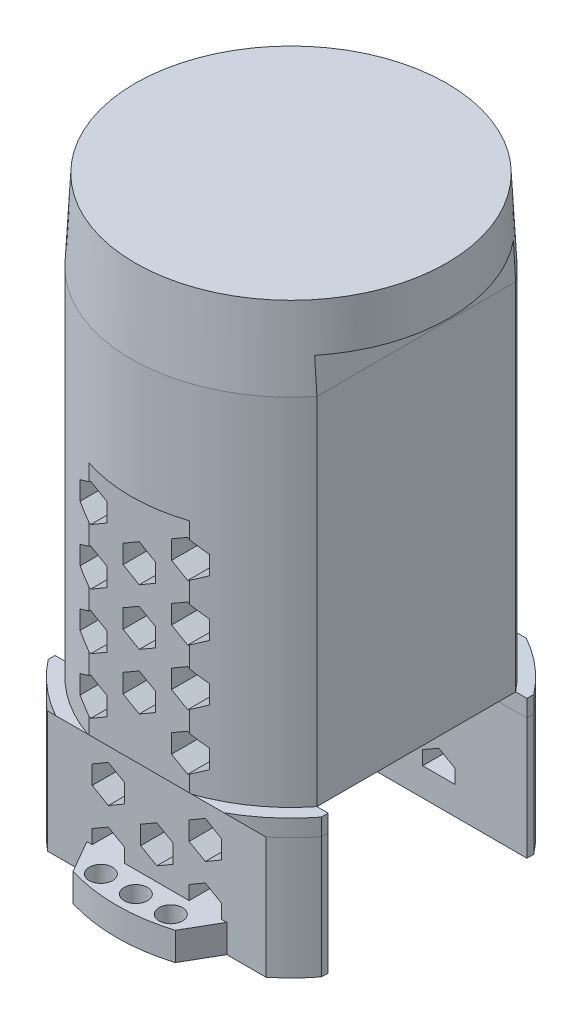
from build123d import *
from build123d.topology import SkipClean

# Parameters (mm, degrees)
BOSS_EXTRUDE1_DEPTH     = 520.7
BOSS_EXTRUDE1_2_DEPTH   = 520.7
SKETCH2_R               = 38.1
BOSS_EXTRUDE2_DEPTH     = 10
BOSS_EXTRUDE3_START     = -10
BOSS_EXTRUDE3_DEPTH     = 10
SKETCH4_R               = 2.5
CUT_EXTRUDE1_DEPTH      = 20
SKETCH10_W              = 228.663028749
SKETCH10_H              = 344.363478489
CUT_EXTRUDE4_DEPTH      = 410.956314746
SKETCH11_W              = 60.14534243
SKETCH11_H              = 11.693159143
CUT_EXTRUDE5_DEPTH      = 60
CHAMFER1_SIZE           = 10
SKETCH15_W              = 58.572001186
SKETCH15_H              = 104.3
BOSS_EXTRUDE7_DEPTH     = 1.465
SKETCH16_W              = 58.572001186
SKETCH16_H              = 104.3
BOSS_EXTRUDE8_DEPTH     = 1.465
FILL_START              = -28.775868134
FILL_PATTERN1_DEPTH     = 57.551736268
FILL_START_2            = -32.547438946
FILL_PATTERN2_DEPTH     = 65.094877892
BOSS_EXTRUDE4_START     = -6
SKETCH12_R              = 2.5
BOSS_EXTRUDE4_DEPTH     = 6
CUT_EXTRUDE6_DEPTH      = 127.363404522
CUT_EXTRUDE6_DEPTH_BACK = 127.363404522
SKETCH17_R              = 69.16149428
SKETCH17_R_2            = 37.4142
SKETCH18_W              = 106.589202293
SKETCH18_H              = 22.606
SKETCH18_H_2            = 1.34818374
CUT_EXTRUDE7_DEPTH      = 527.221851961
SKETCH19_W              = 10.555138929
SKETCH19_H              = 5.43269377
BOSS_EXTRUDE9_DEPTH     = 7.465
SKETCH20_W              = 9.747090017
SKETCH20_H              = 5.698331162
BOSS_EXTRUDE10_DEPTH    = 7.465
SKETCH21_W              = 30
SKETCH21_H              = 6
BOSS_EXTRUDE11_DEPTH    = 7.465
SKETCH22_W              = 30
SKETCH22_H              = 6
BOSS_EXTRUDE12_DEPTH    = 7.465
SKETCH23_R              = 43.655368591
SKETCH23_R_2            = 34.29
CUT_EXTRUDE8_DEPTH      = 60.6552
CUT_EXTRUDE10_DEPTH     = 72.644
BOSS_EXTRUDE13_DEPTH    = 15.5448
REVOLVE2_ANGLE          = 103.150054
REVOLVE3_ANGLE          = 103.150054
SKETCH30_W              = 58.572001186
SKETCH30_H              = 42.621736268
CUT_EXTRUDE11_DEPTH     = 7.356600002
BOSS_EXTRUDE14_REACH    = 559.739


with BuildPart() as part:
    # Sketch1 → Boss-Extrude1 (new body)
    with BuildSketch(Plane(origin=(0, 0, 0), x_dir=(1, 0, 0), z_dir=(0, 1, 0))):
        with BuildLine():
            Line((-29.286000593, 22.775868134), (29.286000593, 22.775868134))
            ThreePointArc((29.286000593, 22.775868134), (24.047840596, 28.250864813), (17.806577944, 32.547438946))
            Line((17.806577944, 32.547438946), (-17.806577944, 32.547438946))
            ThreePointArc((-17.806577944, 32.547438946), (-24.047840596, 28.250864813), (-29.286000593, 22.775868134))
        make_face()
    extrude(amount=BOSS_EXTRUDE1_DEPTH)



with BuildPart() as body_2:
    # Sketch1 → Boss-Extrude1 2 (new body)
    with BuildSketch(Plane(origin=(0, 0, 0), x_dir=(1, 0, 0), z_dir=(0, 1, 0))):
        with BuildLine():
            Line((29.286000593, -22.775868134), (-29.286000593, -22.775868134))
            ThreePointArc((-29.286000593, -22.775868134), (-24.047840596, -28.250864813), (-17.806577944, -32.547438946))
            Line((-17.806577944, -32.547438946), (17.806577944, -32.547438946))
            ThreePointArc((17.806577944, -32.547438946), (24.047840596, -28.250864813), (29.286000593, -22.775868134))
        make_face()
    extrude(amount=BOSS_EXTRUDE1_2_DEPTH)


with BuildPart() as part_1:
    add(part.part)

    add(body_2.part)  # Boss-Extrude2 merges body 2
    # Sketch2 → Boss-Extrude2 (add)
    with BuildSketch(Plane(origin=(0, 520.7, 0), x_dir=(1, 0, 0), z_dir=(0, 1, 0))):
        with Locations(Location((0, 0, 0), (0, 0, 270))):
            Circle(SKETCH2_R)
    extrude(amount=-BOSS_EXTRUDE2_DEPTH)

    # Sketch3 → Boss-Extrude3 (add)
    with BuildSketch(Plane.XZ.offset(BOSS_EXTRUDE3_START)):
        with BuildLine():
            Line((-29.286000593, -22.775868134), (29.286000593, -22.775868134))
            Line((29.286000593, -22.775868134), (30.542917849, -22.775868134))
            ThreePointArc((30.542917849, -22.775868134), (0, -38.1), (-30.542917849, -22.775868134))
            Line((-30.542917849, -22.775868134), (-29.286000593, -22.775868134))
        make_face()
        with BuildLine():
            Line((-29.286000593, 22.775868134), (29.286000593, 22.775868134))
            Line((29.286000593, 22.775868134), (30.542917849, 22.775868134))
            ThreePointArc((30.542917849, 22.775868134), (0, 38.1), (-30.542917849, 22.775868134))
            Line((-30.542917849, 22.775868134), (-29.286000593, 22.775868134))
        make_face()
    extrude(amount=BOSS_EXTRUDE3_DEPTH)

    # Sketch4 → Cut-Extrude1 (cut)
    with BuildSketch(Plane.XZ):
        with Locations(Location((0, -28.335, 0), (0, 0, 270))):
            Circle(SKETCH4_R)
        with Locations(Location((0, 28.335, 0), (0, 0, 270))):
            Circle(SKETCH4_R)
    extrude(amount=-CUT_EXTRUDE1_DEPTH, mode=Mode.SUBTRACT)

    # Sketch8 → Cut-Revolve2 (revolve, cut)
    with BuildSketch(Plane.XY):
        with BuildLine():
            Line((16.1, 495.7), (37.435, 495.7))
            ThreePointArc((37.435, 495.7), (31.186123177, 510.786123177), (16.1, 517.035))
            Line((16.1, 517.035), (16.1, 495.7))
        make_face()
    revolve(axis=Axis((16.1, 350.131058927, 0), (0, -1, 0)), mode=Mode.SUBTRACT)

    # Sketch10 → Cut-Extrude4 (cut, through all)
    with BuildSketch(Plane(origin=(0, 406.4, 0), x_dir=(1, 0, 0), z_dir=(0, 1, 0))):
        with Locations((-56.261180592, -63.179196441)):
            Rectangle(SKETCH10_W, SKETCH10_H)
    extrude(amount=-CUT_EXTRUDE4_DEPTH, mode=Mode.SUBTRACT)

    # Sketch11 → Cut-Extrude5 (cut)
    with BuildSketch(Plane.XZ.offset(-406.4)):
        with Locations((1.82406213, -34.622447706)):
            Rectangle(SKETCH11_W, SKETCH11_H)
        with Locations((1.82406213, 34.622447706)):
            Rectangle(SKETCH11_W, SKETCH11_H)
    extrude(amount=-CUT_EXTRUDE5_DEPTH, mode=Mode.SUBTRACT)

    # Chamfer1
    # the kernel refuses this chamfer: 10 mm, written as the material it adds along each edge
    with BuildSketch(Plane(origin=(-49.133905127, 466.4, 28.775868134), x_dir=(0, 0, 1), z_dir=(1, 0, 0))) as chamfer1_piece_1_section:
        Polygon((CHAMFER1_SIZE, 0), (0, CHAMFER1_SIZE), (0, 0), align=None)
    chamfer1_piece_1 = extrude(amount=98.267810253, mode=Mode.PRIVATE)
    chamfer1_piece_1 = chamfer1_piece_1 & Plane(origin=(0, 466.4, 0), x_dir=(0.47996166963954423, 0, 0.8772894594584054), z_dir=(0, -1, 0)) * Cylinder(37.1, 237, mode=Mode.PRIVATE)
    chamfer1_piece_1 = split(chamfer1_piece_1, bisect_by=Plane(origin=(-49.133905127, 466.4, 32.547438946), z_dir=(0, 0, -1)), keep=Keep.TOP, mode=Mode.PRIVATE)
    add(chamfer1_piece_1)
    with BuildSketch(Plane(origin=(-49.133905127, 466.4, -28.775868134), x_dir=(0, -1, 0), z_dir=(1, 0, 0))) as chamfer1_piece_2_section:
        Polygon((CHAMFER1_SIZE, 0), (0, CHAMFER1_SIZE), (0, 0), align=None)
    chamfer1_piece_2 = extrude(amount=98.267810253, mode=Mode.PRIVATE)
    chamfer1_piece_2 = chamfer1_piece_2 & Plane(origin=(0, 466.4, 0), x_dir=(0.7893800698922699, 0, -0.6139048014610043), z_dir=(0, -1, 0)) * Cylinder(37.1, 237, mode=Mode.PRIVATE)
    chamfer1_piece_2 = split(chamfer1_piece_2, bisect_by=Plane(origin=(-49.133905127, 466.4, -32.547438946), z_dir=(0, 0, 1)), keep=Keep.TOP, mode=Mode.PRIVATE)
    add(chamfer1_piece_2)

    # Sketch15 → Boss-Extrude7 (add)
    with BuildSketch(Plane.XY.offset(-22.775868134)):
        with Locations((0, 458.55)):
            Rectangle(SKETCH15_W, SKETCH15_H)
    extrude(amount=BOSS_EXTRUDE7_DEPTH)

    # Sketch16 → Boss-Extrude8 (add)
    with BuildSketch(Plane(origin=(0, 0, 22.775868134), x_dir=(-1, 0, 0), z_dir=(0, 0, -1))):
        with Locations((0, 458.55)):
            Rectangle(SKETCH16_W, SKETCH16_H)
    extrude(amount=BOSS_EXTRUDE8_DEPTH)

    # Fill Pattern1: read off the stored shape, not the designer's step
    # Fill Pattern1 outline → Fill Pattern1 (cut)
    with BuildSketch(Plane.XY.offset(FILL_START)):
        Polygon((-10.392304845, 409.4), (-6.92820323, 411.4), (-6.92820323, 415.4), (-10.392304845, 417.4), (-13.856406461, 415.4), (-13.856406461, 411.4), align=None)
        Polygon((0, 415.4), (3.464101615, 417.4), (3.464101615, 421.4), (0, 423.4), (-3.464101615, 421.4), (-3.464101615, 417.4), align=None)
        Polygon((10.392304845, 421.4), (13.856406461, 423.4), (13.856406461, 427.4), (10.392304845, 429.4), (6.92820323, 427.4), (6.92820323, 423.4), align=None)
        Polygon((-6.92820323, 423.4), (-6.92820323, 427.4), (-10.392304845, 429.4), (-13.856406461, 427.4), (-13.856406461, 423.4), (-10.392304845, 421.4), align=None)
        Polygon((-6.92820323, 435.4), (-6.92820323, 439.4), (-10.392304845, 441.4), (-13.856406461, 439.4), (-13.856406461, 435.4), (-10.392304845, 433.4), align=None)
        Polygon((-6.92820323, 447.4), (-6.92820323, 451.4), (-10.392304845, 453.4), (-13.856406461, 451.4), (-13.856406461, 447.4), (-10.392304845, 445.4), align=None)
        Polygon((0, 427.4), (3.464101615, 429.4), (3.464101615, 433.4), (0, 435.4), (-3.464101615, 433.4), (-3.464101615, 429.4), align=None)
        Polygon((10.392304845, 433.4), (13.856406461, 435.4), (13.856406461, 439.4), (10.392304845, 441.4), (6.92820323, 439.4), (6.92820323, 435.4), align=None)
        Polygon((13.856406461, 415.4), (10.392304845, 417.4), (6.92820323, 415.4), (6.92820323, 411.4), (10.392304845, 409.4), (13.856406461, 411.4), align=None)
        Polygon((0, 439.4), (3.464101615, 441.4), (3.464101615, 445.4), (0, 447.4), (-3.464101615, 445.4), (-3.464101615, 441.4), align=None)
        Polygon((10.392304845, 445.4), (13.856406461, 447.4), (13.856406461, 451.4), (10.392304845, 453.4), (6.92820323, 451.4), (6.92820323, 447.4), align=None)
    extrude(amount=FILL_PATTERN1_DEPTH, mode=Mode.SUBTRACT)

    # Fill Pattern2: read off the stored shape, not the designer's step
    # Fill Pattern2 outline → Fill Pattern2 (cut)
    with BuildSketch(Plane.XY.offset(FILL_START_2)):
        Polygon((-10.392304845, 463.435785406), (-6.92820323, 465.435785406), (-6.92820323, 469.435785406), (-10.392304845, 471.435785406), (-13.856406461, 469.435785406), (-13.856406461, 465.435785406), align=None)
        Polygon((0, 469.435785406), (3.464101615, 471.435785406), (3.464101615, 475.435785406), (0, 477.435785406), (-3.464101615, 475.435785406), (-3.464101615, 471.435785406), align=None)
        Polygon((10.392304845, 475.435785406), (13.856406461, 477.435785406), (13.856406461, 481.435785406), (10.392304845, 483.435785406), (6.92820323, 481.435785406), (6.92820323, 477.435785406), align=None)
        Polygon((-6.92820323, 477.435785406), (-6.92820323, 481.435785406), (-10.392304845, 483.435785406), (-13.856406461, 481.435785406), (-13.856406461, 477.435785406), (-10.392304845, 475.435785406), align=None)
        Polygon((-6.92820323, 489.435785406), (-6.92820323, 493.435785406), (-10.392304845, 495.435785406), (-13.856406461, 493.435785406), (-13.856406461, 489.435785406), (-10.392304845, 487.435785406), align=None)
        Polygon((-6.92820323, 501.435785406), (-6.92820323, 505.435785406), (-10.392304845, 507.435785406), (-13.856406461, 505.435785406), (-13.856406461, 501.435785406), (-10.392304845, 499.435785406), align=None)
        Polygon((0, 481.435785406), (3.464101615, 483.435785406), (3.464101615, 487.435785406), (0, 489.435785406), (-3.464101615, 487.435785406), (-3.464101615, 483.435785406), align=None)
        Polygon((10.392304845, 487.435785406), (13.856406461, 489.435785406), (13.856406461, 493.435785406), (10.392304845, 495.435785406), (6.92820323, 493.435785406), (6.92820323, 489.435785406), align=None)
        Polygon((13.856406461, 469.435785406), (10.392304845, 471.435785406), (6.92820323, 469.435785406), (6.92820323, 465.435785406), (10.392304845, 463.435785406), (13.856406461, 465.435785406), align=None)
        Polygon((0, 493.435785406), (3.464101615, 495.435785406), (3.464101615, 499.435785406), (0, 501.435785406), (-3.464101615, 499.435785406), (-3.464101615, 495.435785406), align=None)
        Polygon((10.392304845, 499.435785406), (13.856406461, 501.435785406), (13.856406461, 505.435785406), (10.392304845, 507.435785406), (6.92820323, 505.435785406), (6.92820323, 501.435785406), align=None)
    extrude(amount=FILL_PATTERN2_DEPTH, mode=Mode.SUBTRACT)

    # Sketch12 → Boss-Extrude4 (add)
    # profile 1 of 2: a face of its own
    with BuildSketch(Plane.XZ.offset(-406.4).offset(BOSS_EXTRUDE4_START)):
        with BuildLine():
            Line((-10.46231785, 36.635364167), (-15, 28.775868134))
            Line((-15, 28.775868134), (-12, 28.775868134))
            Line((-12, 28.775868134), (12, 28.775868134))
            Line((12, 28.775868134), (15, 28.775868134))
            Line((15, 28.775868134), (10.46231785, 36.635364167))
            ThreePointArc((10.46231785, 36.635364167), (0, 38.100000032), (-10.46231785, 36.635364167))
        make_face()
        with Locations(Location((-7.5, 33.275868134, 0), (0, 0, 270))):
            Circle(SKETCH12_R, mode=Mode.SUBTRACT)
        with Locations(Location((0, 33.275868134, 0), (0, 0, 270))):
            Circle(SKETCH12_R, mode=Mode.SUBTRACT)
        with Locations(Location((7.5, 33.275868134, 0), (0, 0, 270))):
            Circle(SKETCH12_R, mode=Mode.SUBTRACT)
    # profile 2 of 2: a face of its own
    with BuildSketch(Plane.XZ.offset(-406.4).offset(BOSS_EXTRUDE4_START)):
        with BuildLine():
            Line((-15, -28.775868134), (-10.46231785, -36.635364167))
            ThreePointArc((-10.46231785, -36.635364167), (0, -38.100000032), (10.46231785, -36.635364167))
            Line((10.46231785, -36.635364167), (15, -28.775868134))
            Line((15, -28.775868134), (12, -28.775868134))
            Line((12, -28.775868134), (-12, -28.775868134))
            Line((-12, -28.775868134), (-15, -28.775868134))
        make_face()
        with Locations(Location((-7.5, -33.275868134, 0), (0, 0, 270))):
            Circle(SKETCH12_R, mode=Mode.SUBTRACT)
        with Locations(Location((0, -33.275868134, 0), (0, 0, 270))):
            Circle(SKETCH12_R, mode=Mode.SUBTRACT)
        with Locations(Location((7.5, -33.275868134, 0), (0, 0, 270))):
            Circle(SKETCH12_R, mode=Mode.SUBTRACT)
    extrude(amount=BOSS_EXTRUDE4_DEPTH)

    # Sketch17 → Cut-Extrude6 (cut, two sides: drawn at the far end of the back side and taken through both)
    with BuildSketch(Plane(origin=(0, 520.7, 0), x_dir=(1, 0, 0), z_dir=(0, 1, 0)).offset(-CUT_EXTRUDE6_DEPTH_BACK)):
        Circle(SKETCH17_R)
        with Locations(Location((0, 0, 0), (0, 0, 270))):
            Circle(SKETCH17_R_2, mode=Mode.SUBTRACT)
    extrude(amount=CUT_EXTRUDE6_DEPTH + CUT_EXTRUDE6_DEPTH_BACK, mode=Mode.SUBTRACT)

    # Sketch18 → Cut-Extrude7 (cut, through all)
    with BuildSketch(Plane(origin=(0, 0, -28.775868134), x_dir=(-1, 0, 0), z_dir=(0, 0, -1))):
        with Locations((2.213754723, 445.097)):
            Rectangle(SKETCH18_W, SKETCH18_H)
        with Locations((2.213754723, 433.11990813)):
            Rectangle(SKETCH18_W, SKETCH18_H_2)
    extrude(amount=-CUT_EXTRUDE7_DEPTH, mode=Mode.SUBTRACT)


with BuildPart() as cut_extrude7_piece_1:
    # of the separate pieces the step leaves, piece 1, a body of its own (cut_extrude7_pieces)
    add(part_1.part.solids().sort_by_distance((-23.417075247, 456.4, -28.775868134))[0])

    # Sketch23 → Cut-Extrude8 (cut)
    with BuildSketch(Plane(origin=(0, 520.7, 0), x_dir=(1, 0, 0), z_dir=(0, 1, 0))):
        Circle(SKETCH23_R)
        with Locations(Location((0, 0, 0), (0, 0, 270))):
            Circle(SKETCH23_R_2, mode=Mode.SUBTRACT)
    extrude(amount=-CUT_EXTRUDE8_DEPTH, mode=Mode.SUBTRACT)

    # Sketch25 → Cut-Extrude10 (cut)
    with BuildSketch(Plane.XZ.offset(-510.7)):
        with BuildLine():
            Line((26.863562671, 21.310868134), (-26.863562671, 21.310868134))
            ThreePointArc((-26.863562671, 21.310868134), (-34.29, 0), (-26.863562671, -21.310868134))
            Line((-26.863562671, -21.310868134), (26.863562671, -21.310868134))
            ThreePointArc((26.863562671, -21.310868134), (34.29, 0), (26.863562671, 21.310868134))
        make_face()
    extrude(amount=-CUT_EXTRUDE10_DEPTH, mode=Mode.SUBTRACT)


with BuildPart() as cut_extrude7_piece_2:
    # of the separate pieces the step leaves, piece 2, a body of its own (cut_extrude7_pieces)
    add(part_1.part.solids().sort_by_distance((29.286000593, 406.4, 22.775868134))[0])

    # Sketch20 → Boss-Extrude10 (add)
    with BuildSketch(Plane.XY.offset(28.775868134)):
        with Locations((-0.339567195, 429.596650679)):
            Rectangle(SKETCH20_W, SKETCH20_H)
    extrude(amount=-BOSS_EXTRUDE10_DEPTH)


with BuildPart() as cut_extrude7_piece_3:
    # of the separate pieces the step leaves, piece 3, a body of its own (cut_extrude7_pieces)
    add(part_1.part.solids().sort_by_distance((-23.417075247, 406.4, -28.775868134))[0])

    # Sketch19 → Boss-Extrude9 (add)
    with BuildSketch(Plane(origin=(0, 0, -28.775868134), x_dir=(-1, 0, 0), z_dir=(0, 0, -1))):
        with Locations((-0.044517211, 429.729469375)):
            Rectangle(SKETCH19_W, SKETCH19_H)
    extrude(amount=-BOSS_EXTRUDE9_DEPTH)


with BuildPart() as cut_extrude7_piece_2_1:
    # Body-Move/Copy1: read off the stored shape, not the designer's step
    # Body-Move/Copy1: moved
    add(cut_extrude7_piece_2.part.moved(Location((0, 23.9541837, 0))))

    # Sketch22 → Boss-Extrude12 (add)
    with BuildSketch(Plane(origin=(0, 0, 28.775868134), x_dir=(-1, 0, 0), z_dir=(0, 0, -1))):
        with Locations((0, 433.35418374)):
            Rectangle(SKETCH22_W, SKETCH22_H)
    extrude(amount=BOSS_EXTRUDE12_DEPTH)


with BuildPart() as cut_extrude7_piece_3_1:
    # Body-Move_Copy1 2: moved
    add(cut_extrude7_piece_3.part.moved(Location((0, 23.9541837, 0))))

    # Sketch21 → Boss-Extrude11 (add)
    with BuildSketch(Plane.XY.offset(-28.775868134)):
        with Locations((0, 433.35418374)):
            Rectangle(SKETCH21_W, SKETCH21_H)
    extrude(amount=BOSS_EXTRUDE11_DEPTH)


with BuildPart() as cut_extrude10_piece_1:
    # of the separate pieces the step leaves, piece 1, a body of its own (cut_extrude10_pieces)
    add(cut_extrude7_piece_1.part.solids().sort_by_distance((-18.03635988, 460.0448, -32.420668134))[0])



with BuildPart() as cut_extrude10_piece_2:
    # of the separate pieces the step leaves, piece 2, a body of its own (cut_extrude10_pieces)
    add(cut_extrude7_piece_1.part.solids().sort_by_distance((-10.792048835, 510.7, 32.547438946))[0])


with BuildPart() as body_5:
    # Sketch26 → Revolve1 (revolve)
    with BuildSketch(Plane(origin=(0, 0, 0), x_dir=(0, 0, -1), z_dir=(1, 0, 0))):
        Polygon((0, 553.601400002), (0, 543.601400002), (33.913197089, 543.601400002), (33.401, 553.601400002), align=None)
    revolve(axis=Axis((0, 520.7, 0), (0, 1, 0)))


with BuildPart() as cut_extrude10_piece_1_1:
    with SkipClean():  # the faces are left unmerged after this step: merging them gives an invalid solid
        add(cut_extrude10_piece_1.part)

        add(cut_extrude10_piece_2.part)  # Boss-Extrude13 merges Cut-Extrude10 piece 2
        # Sketch27 → Boss-Extrude13 (add)
        with BuildSketch(Plane(origin=(0, 520.7, 0), x_dir=(1, 0, 0), z_dir=(0, 1, 0))):
            with BuildLine():
                Line((26.863562671, -21.310868134), (-26.863562671, -21.310868134))
                ThreePointArc((-26.863562671, -21.310868134), (0, -34.29), (26.863562671, -21.310868134))
            make_face()
            with BuildLine():
                Line((-26.863562671, 21.310868134), (26.863562671, 21.310868134))
                ThreePointArc((26.863562671, 21.310868134), (0, 34.29), (-26.863562671, 21.310868134))
            make_face()
        extrude(amount=BOSS_EXTRUDE13_DEPTH)


    # Revolve2: read off the stored shape, not the designer's step
    with SkipClean():  # the faces are left unmerged after this step: merging them gives an invalid solid
        add(body_5.part)  # Revolve2 merges body 5
        # Revolve2 outline → Revolve2 (revolve)
        with BuildSketch(Plane(origin=(0, 0, 0), x_dir=(-0.7834226500663162, 0, 0.6214893010849586), z_dir=(-0.6214893010849586, 0, -0.7834226500663162))):
            Polygon((21.310868134, 543.601400002), (21.310868134, 536.2448), (34.29, 536.2448), (33.913197089, 543.601400002), align=None)
        revolve(axis=Axis((0, 0, 0), (0, 1, 0)), revolution_arc=REVOLVE2_ANGLE)

    # Revolve3: read off the stored shape, not the designer's step
    # Revolve3 outline → Revolve3 (revolve)
    with SkipClean():  # the faces are left unmerged after this step: merging them gives an invalid solid
        with BuildSketch(Plane(origin=(0, 0, 0), x_dir=(0.7834226500663153, 0, -0.6214893010849597), z_dir=(0.6214893010849597, 0, 0.7834226500663153))):
            Polygon((21.310868134, 543.601400002), (21.310868134, 536.2448), (34.29, 536.2448), (33.913197089, 543.601400002), align=None)
        revolve(axis=Axis((0, 0, 0), (0, 1, 0)), revolution_arc=REVOLVE3_ANGLE)

    # Sketch30 → Cut-Extrude11 (cut)
    with SkipClean():  # the faces are left unmerged after this step: merging them gives an invalid solid
        with BuildSketch(Plane.XZ.offset(-536.2448)):
            Rectangle(SKETCH30_W, SKETCH30_H)
        extrude(amount=-CUT_EXTRUDE11_DEPTH, mode=Mode.SUBTRACT)

    # Boss-Extrude14: up to this face of the body (flat: up to its plane)
    boss_extrude14_end = Plane(cut_extrude10_piece_1_1.part.faces().sort_by_distance((13.431781359, 535.254554, 21.310868134))[0])
    # Sketch31 → Boss-Extrude14 (add, up to the picked face)
    with BuildSketch(Plane.XY.offset(-21.310868134), mode=Mode.PRIVATE) as boss_extrude14_sk1:
        with BuildLine():
            Line((22.335, 460.0448), (26.863562671, 460.0448))
            Line((26.863562671, 460.0448), (26.863562671, 536.2448))
            ThreePointArc((26.863562671, 536.2448), (26.622656238, 539.923127909), (26.380899078, 543.601400002))
            Line((26.380899078, 543.601400002), (22.335, 543.601400002))
            Line((22.335, 543.601400002), (22.335, 460.0448))
        make_face()
    boss_extrude14_tool1 = split(extrude(boss_extrude14_sk1.sketch, amount=BOSS_EXTRUDE14_REACH, mode=Mode.PRIVATE), bisect_by=boss_extrude14_end, keep=Keep.BOTH, mode=Mode.PRIVATE)
    # Sketch31 → Boss-Extrude14 (add, up to the picked face)
    with BuildSketch(Plane.XY.offset(-21.310868134), mode=Mode.PRIVATE) as boss_extrude14_sk2:
        with BuildLine():
            Line((-26.863562671, 460.0448), (-22.335, 460.0448))
            Line((-22.335, 460.0448), (-22.335, 543.601400002))
            Line((-22.335, 543.601400002), (-26.380899078, 543.601400002))
            ThreePointArc((-26.380899078, 543.601400002), (-26.622656238, 539.923127909), (-26.863562671, 536.2448))
            Line((-26.863562671, 536.2448), (-26.863562671, 460.0448))
        make_face()
    boss_extrude14_tool2 = split(extrude(boss_extrude14_sk2.sketch, amount=BOSS_EXTRUDE14_REACH, mode=Mode.PRIVATE), bisect_by=boss_extrude14_end, keep=Keep.BOTH, mode=Mode.PRIVATE)
    add(boss_extrude14_tool1.solids().sort_by(Axis((24.589377, 501.637928, -21.310868), (0, 0, 1)))[0])
    add(boss_extrude14_tool2.solids().sort_by(Axis((-24.589377, 501.637928, -21.310868), (0, 0, 1)))[0])


solid = Compound([cut_extrude7_piece_2_1.part, cut_extrude7_piece_3_1.part, cut_extrude10_piece_1_1.part])
